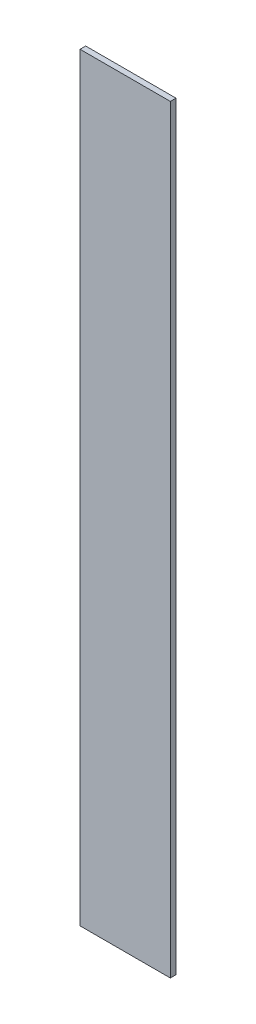
from build123d import *

# Parameters (mm, degrees)
SKETCH1_W           = 50.8
SKETCH1_H           = 3.175
BOSS_EXTRUDE1_DEPTH = 427.1518


with BuildPart() as part:
    # Sketch1 → Boss-Extrude1 (new body)
    with BuildSketch(Plane(origin=(0, 0, 0), x_dir=(1, 0, 0), z_dir=(0, 1, 0))):
        with Locations((0, 70.254548969)):
            Rectangle(SKETCH1_W, SKETCH1_H)
    extrude(amount=BOSS_EXTRUDE1_DEPTH)


solid = part.part
